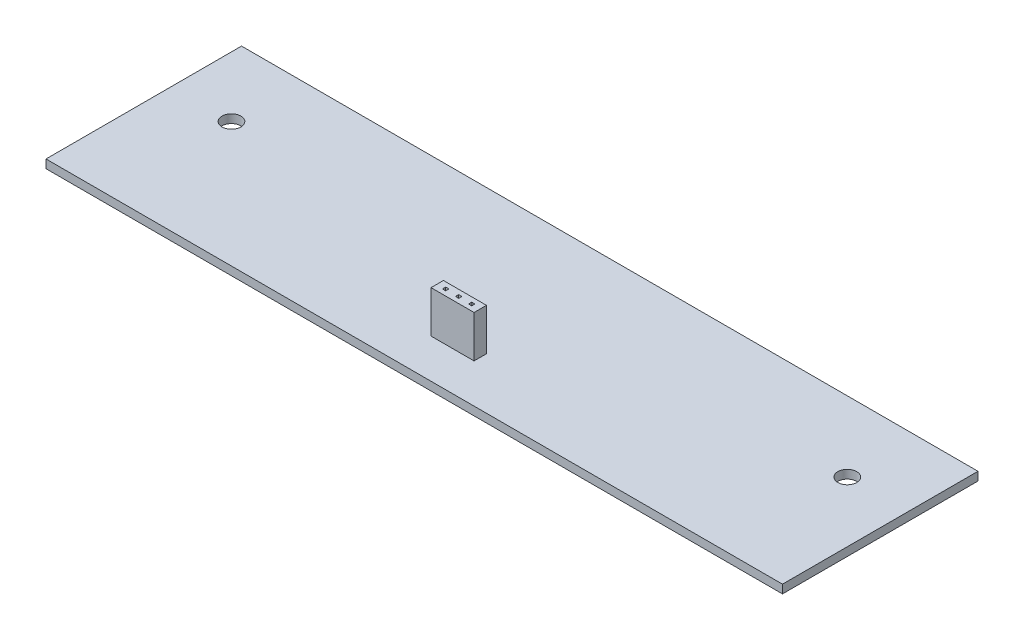
from build123d import *

# Parameters (mm, degrees)
ESQUISSE1_W             = 143.51
ESQUISSE1_H             = 38.1
BOSS_EXTRU_1_DEPTH      = 1.651
ESQUISSE2_R             = 1.8415
ENL_V_MAT_EXTRU_1_DEPTH = 75.259062248
ESQUISSE3_W             = 8.382
ESQUISSE3_H             = 2.413
BOSS_EXTRU_2_DEPTH      = 8.1788
ESQUISSE4_W             = 0.635
ESQUISSE4_H             = 0.635
ENL_V_MAT_EXTRU_2_DEPTH = 5.08


with BuildPart() as part:
    # Esquisse1 → Boss.-Extru.1 (new body)
    with BuildSketch(Plane(origin=(0, 0, 0), x_dir=(1, 0, 0), z_dir=(0, 1, 0))):
        Rectangle(ESQUISSE1_W, ESQUISSE1_H)
    extrude(amount=BOSS_EXTRU_1_DEPTH)

    # Esquisse2 → Enlèv. mat.-Extru.1 (cut, through all)
    with BuildSketch(Plane(origin=(0, 1.651, 0), x_dir=(1, 0, 0), z_dir=(0, 1, 0))):
        with Locations((60, 5.334)):
            Circle(ESQUISSE2_R)
        with Locations((-60, 5.334)):
            Circle(ESQUISSE2_R)
    extrude(amount=-ENL_V_MAT_EXTRU_1_DEPTH, mode=Mode.SUBTRACT)

    # Esquisse3 → Boss.-Extru.2 (add)
    with BuildSketch(Plane(origin=(0, 1.651, 0), x_dir=(1, 0, 0), z_dir=(0, 1, 0))):
        with Locations((-0.154698586, -10.2235)):
            Rectangle(ESQUISSE3_W, ESQUISSE3_H)
    extrude(amount=BOSS_EXTRU_2_DEPTH)

    # Esquisse4 → Enlèv. mat.-Extru.2 (cut)
    with BuildSketch(Plane(origin=(0, 9.8298, 0), x_dir=(1, 0, 0), z_dir=(0, 1, 0))):
        with Locations((-0.154698586, -10.2235)):
            Rectangle(ESQUISSE4_W, ESQUISSE4_H)
        with Locations((-2.694698586, -10.2235)):
            Rectangle(ESQUISSE4_W, ESQUISSE4_H)
        with Locations((2.385301414, -10.2235)):
            Rectangle(ESQUISSE4_W, ESQUISSE4_H)
    extrude(amount=-ENL_V_MAT_EXTRU_2_DEPTH, mode=Mode.SUBTRACT)


solid = part.part
